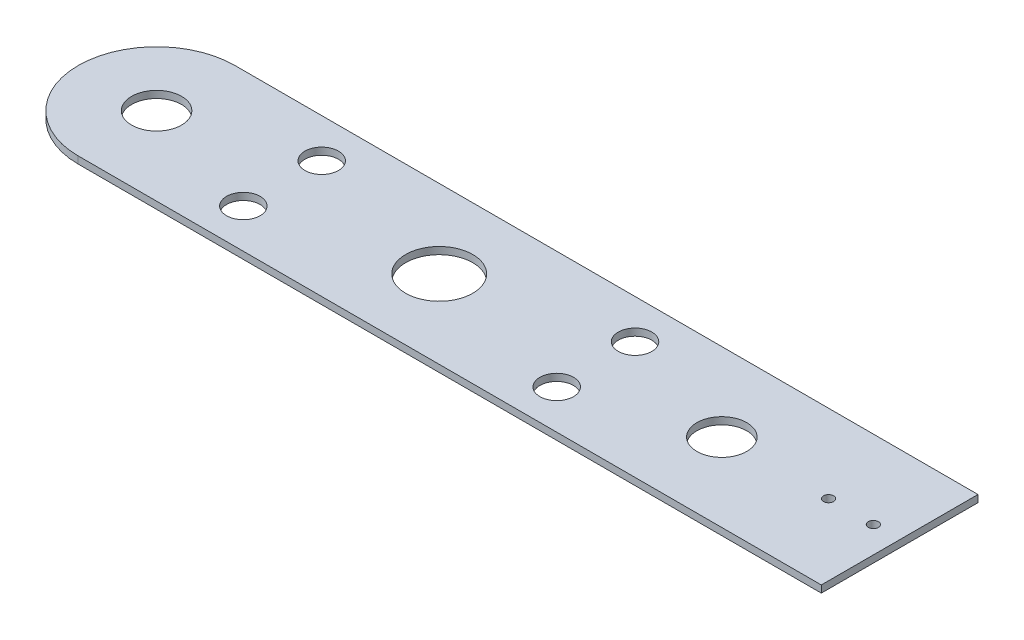
from build123d import *

# Parameters (mm, degrees)
SKETCH1_R           = 11.15
SKETCH1_R_2         = 7.5
SKETCH1_R_3         = 2.25
BOSS_EXTRUDE1_DEPTH = 3.175


with BuildPart() as part:
    # Sketch1 → Boss-Extrude1 (new body)
    with BuildSketch(Plane(origin=(0, 0, 0), x_dir=(1, 0, 0), z_dir=(0, 1, 0))):
        with BuildLine():
            ThreePointArc((-126.258214395, 35), (-161.258214395, 0), (-126.258214395, -35))
            Line((-126.258214395, -35), (205.708214395, -35))
            Line((205.708214395, -35), (205.708214395, 35))
            Line((205.708214395, 35), (-126.258214395, 35))
        make_face()
        with Locations((-126.258214395, 0)):
            Circle(SKETCH1_R, mode=Mode.SUBTRACT)
        with Locations((-70, -17.5)):
            Circle(SKETCH1_R_2, mode=Mode.SUBTRACT)
        with BuildLine():
            ThreePointArc((15, 0), (0, -15), (-15, 0))
            ThreePointArc((-15, 0), (0, 15), (15, 0))
        make_face(mode=Mode.SUBTRACT)
        with Locations((70, -17.5)):
            Circle(SKETCH1_R_2, mode=Mode.SUBTRACT)
        with Locations((173.958214395, 0)):
            Circle(SKETCH1_R_3, mode=Mode.SUBTRACT)
        with Locations((193.958214395, 0)):
            Circle(SKETCH1_R_3, mode=Mode.SUBTRACT)
        with Locations((-70, 17.5)):
            Circle(SKETCH1_R_2, mode=Mode.SUBTRACT)
        with Locations((70, 17.5)):
            Circle(SKETCH1_R_2, mode=Mode.SUBTRACT)
        with Locations((126.258214395, 0)):
            Circle(SKETCH1_R, mode=Mode.SUBTRACT)
    extrude(amount=BOSS_EXTRUDE1_DEPTH)


solid = part.part
